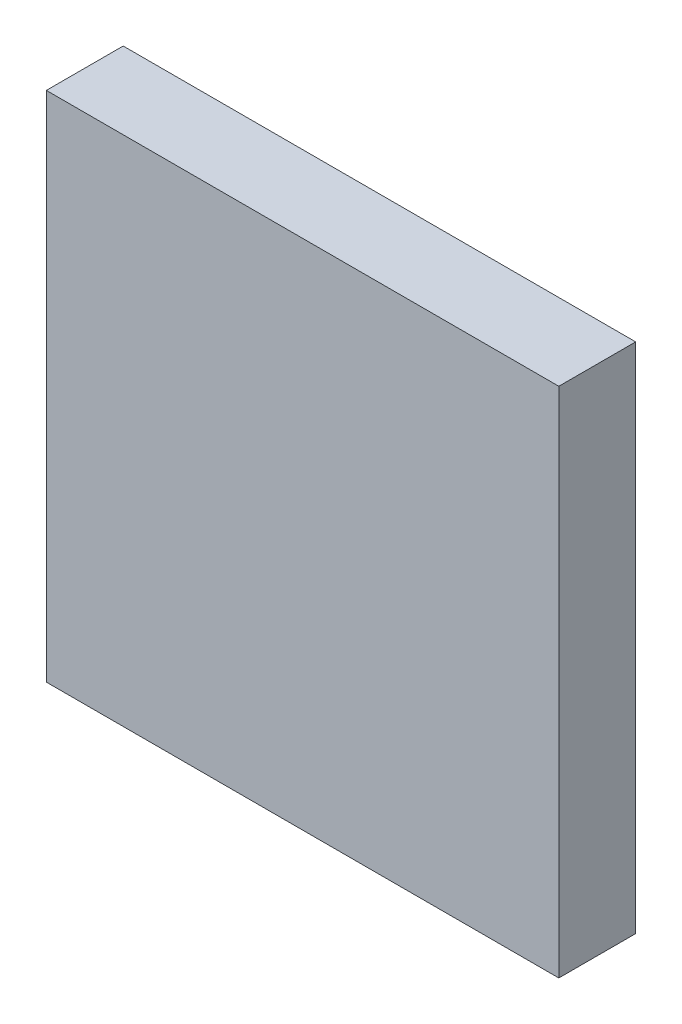
from build123d import *

# Parameters (mm, degrees)
CROQUIS1_W                   = 10
CROQUIS1_H                   = 10
SALIENTE_EXTRUIR6_DEPTH      = 1.5
SALIENTE_EXTRUIR7_DEPTH      = 0.75
SALIENTE_EXTRUIR7_DEPTH_BACK = 0.75


with BuildPart() as part:
    # Croquis1 → Saliente-Extruir6 (new body)
    with BuildSketch(Plane.XY):
        Rectangle(CROQUIS1_W, CROQUIS1_H)
    extrude(amount=SALIENTE_EXTRUIR6_DEPTH)

    # Croquis8 → Saliente-Extruir7 (add, two sides: drawn at the far end of the back side and taken through both)
    with BuildSketch(Plane(origin=(0, 0, 0), x_dir=(0, 0, -1), z_dir=(1, 0, 0)).offset(-SALIENTE_EXTRUIR7_DEPTH_BACK)):
        with BuildLine():
            Line((0, 3), (0, 1.5))
            ThreePointArc((0, 1.5), (1.5, 0), (0, -1.5))
            Line((0, -1.5), (0, -3))
            ThreePointArc((0, -3), (3, 0), (0, 3))
        make_face()
    extrude(amount=SALIENTE_EXTRUIR7_DEPTH + SALIENTE_EXTRUIR7_DEPTH_BACK)


solid = part.part
